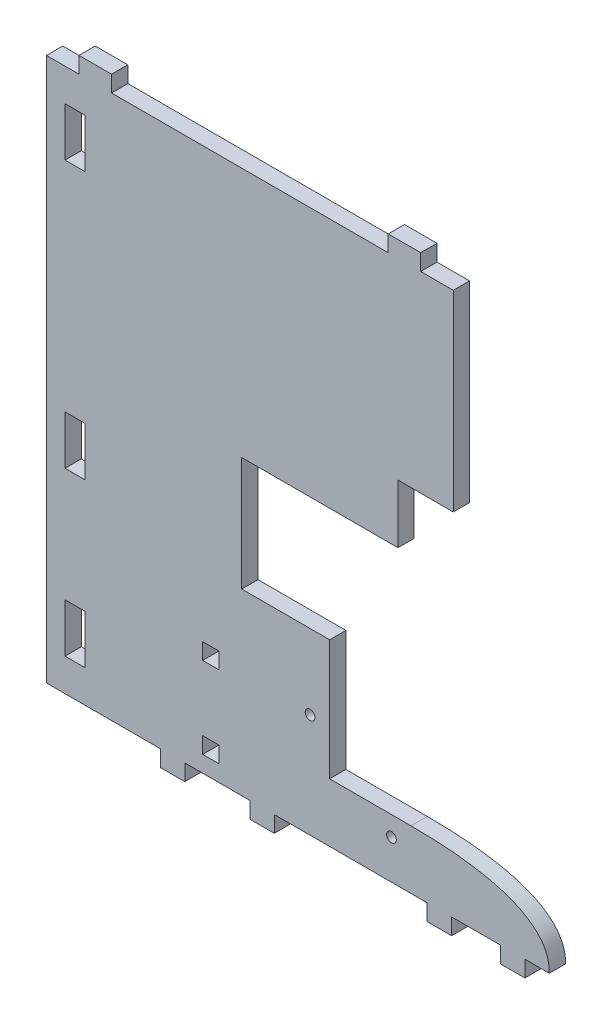
from build123d import *

# Parameters (mm, degrees)
ESQUISSE1_R        = 1.5
BOSS_EXTRU_1_DEPTH = 5
ESQUISSE2_W        = 6.138933528
ESQUISSE2_H        = 15
ESQUISSE2_W_2      = 5
ESQUISSE2_H_2      = 5
BOSS_EXTRU_2_DEPTH = 5


with BuildPart() as part:
    # Esquisse1 → Boss.-Extru.1 (new body)
    with BuildSketch(Plane.XY):
        Polygon((0, 0), (37, 0), (37, 18), (12, 18), (12, 55), (0, 55), align=None)
        with Locations((6, 32)):
            Circle(ESQUISSE1_R, mode=Mode.SUBTRACT)
        with Locations((31, 12)):
            Circle(ESQUISSE1_R, mode=Mode.SUBTRACT)
    extrude(amount=BOSS_EXTRU_1_DEPTH)

    # Esquisse2 → Boss.-Extru.2 (add)
    # profile 1 of 2: a face of its own
    with BuildSketch(Plane.XY.offset(5)):
        with BuildLine():
            Line((37, 0), (42, 0))
            Line((42, 0), (42, -5))
            Line((42, -5), (49.5, -5))
            Line((49.5, -5), (49.5, 0))
            Line((49.5, 0), (64.5, 0))
            Line((64.5, 0), (64.5, -5))
            Line((64.5, -5), (72, -5))
            Line((72, -5), (72, 0))
            Line((72, 0), (79.5, 0))
            add(Edge.make_bspline(
                [(37, 18), (79.239532327, 18), (79.5, 3.874285435), (79.5, 0)],
                knots=[0, 0, 0, 0, 1, 1, 1, 1], degree=3))
            Line((37, 18), (37, 0))
        make_face()
    # profile 2 of 2: a face of its own
    with BuildSketch(Plane.XY.offset(5)):
        Polygon((0, 0), (-5, 0), (-5, -5), (-12.5, -5), (-12.5, 0), (-32.5, 0), (-32.5, -5), (-40, -5), (-40, 0), (-75, 0), (-75, 167), (-65, 167), (-65, 172), (-55, 172), (-55, 167), (30, 167), (30, 172), (40, 172), (40, 167), (50, 167), (50, 108), (33, 108), (33, 90), (-15, 90), (-15, 55), (0, 55), align=None)
        with Locations((-66.228617731, 17.5)):
            Rectangle(ESQUISSE2_W, ESQUISSE2_H, mode=Mode.SUBTRACT)
        with Locations((-66.228617731, 67.5)):
            Rectangle(ESQUISSE2_W, ESQUISSE2_H, mode=Mode.SUBTRACT)
        with Locations((-66.228617731, 149.5)):
            Rectangle(ESQUISSE2_W, ESQUISSE2_H, mode=Mode.SUBTRACT)
        with Locations((-24.5, 7.5)):
            Rectangle(ESQUISSE2_W_2, ESQUISSE2_H_2, mode=Mode.SUBTRACT)
        with Locations((-24.5, 32.5)):
            Rectangle(ESQUISSE2_W_2, ESQUISSE2_H_2, mode=Mode.SUBTRACT)
    extrude(amount=-BOSS_EXTRU_2_DEPTH)


solid = part.part
